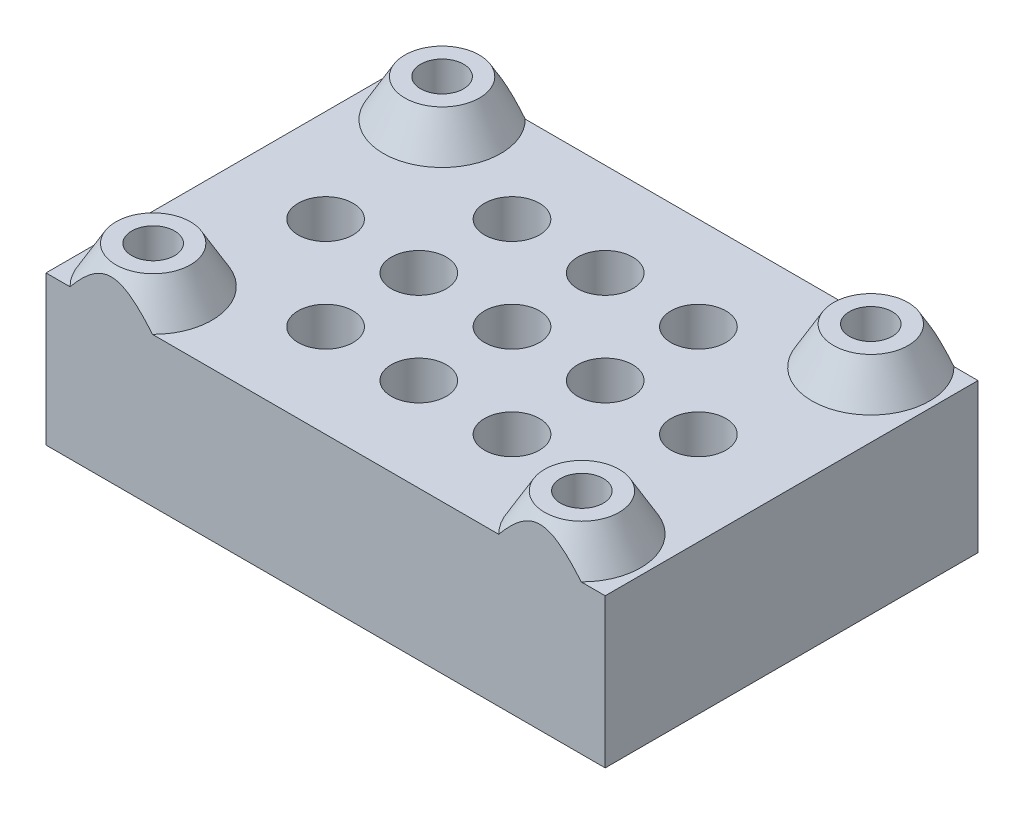
from build123d import *

# Parameters (mm, degrees)
SKETCH1_W               = 30
SKETCH1_H               = 20
BOSS_EXTRUDE1_DEPTH     = 8
SKETCH2_R               = 0.95
CUT_EXTRUDE1_DEPTH      = 20.723082923
BOSS_EXTRUDE2_START     = 2
SKETCH3_R               = 2
SKETCH3_R_2             = 0.95
BOSS_EXTRUDE2_DEPTH     = 2
CHAMFER1_SIZE           = 1.154700538
CHAMFER1_SIZE_2         = 2
SKETCH4_R               = 1.475
CUT_EXTRUDE2_DEPTH      = 21.615528128
LPATTERN1_COUNT         = 5
LPATTERN1_PITCH         = 5
LPATTERN1_COUNT_DIR2    = 2
LPATTERN1_PITCH_DIR2    = 5
MIRROR1_COPY_1_SKETCH_R = 1.475
MIRROR1_COPY_1_DEPTH    = 21.615528128
MIRROR1_COPY_2_SKETCH_R = 1.475
MIRROR1_COPY_2_DEPTH    = 21.615528128
MIRROR1_COPY_3_SKETCH_R = 1.475
MIRROR1_COPY_3_DEPTH    = 21.615528128
MIRROR1_COPY_4_SKETCH_R = 1.475
MIRROR1_COPY_4_DEPTH    = 21.615528128
MIRROR1_COPY_5_SKETCH_R = 1.475
MIRROR1_COPY_5_DEPTH    = 21.615528128
MIRROR1_COPY_6_SKETCH_R = 1.475
MIRROR1_COPY_6_DEPTH    = 21.615528128
MIRROR1_COPY_7_SKETCH_R = 1.475
MIRROR1_COPY_7_DEPTH    = 21.615528128
MIRROR1_COPY_8_SKETCH_R = 1.475
MIRROR1_COPY_8_DEPTH    = 21.615528128
SKETCH5_R               = 1.15
CUT_EXTRUDE3_DEPTH      = 2


with BuildPart() as part:
    # Sketch1 → Boss-Extrude1 (new body)
    with BuildSketch(Plane(origin=(0, 0, 0), x_dir=(1, 0, 0), z_dir=(0, 1, 0))):
        Rectangle(SKETCH1_W, SKETCH1_H)
    extrude(amount=BOSS_EXTRUDE1_DEPTH)

    # Sketch2 → Cut-Extrude1 (cut, through all)
    with BuildSketch(Plane(origin=(0, 8, 0), x_dir=(1, 0, 0), z_dir=(0, 1, 0))):
        with Locations(Location((-11.5, 7.75, 0), (0, 0, 270))):
            Circle(SKETCH2_R)
        with Locations(Location((-11.5, -7.75, 0), (0, 0, 270))):
            Circle(SKETCH2_R)
        with Locations(Location((11.5, -7.75, 0), (0, 0, 270))):
            Circle(SKETCH2_R)
        with Locations(Location((11.5, 7.75, 0), (0, 0, 270))):
            Circle(SKETCH2_R)
    extrude(amount=-CUT_EXTRUDE1_DEPTH, mode=Mode.SUBTRACT)

    # Sketch3 → Boss-Extrude2 (add)
    # profile 1 of 4: a face of its own
    with BuildSketch(Plane(origin=(0, 8, 0), x_dir=(1, 0, 0), z_dir=(0, 1, 0)).offset(BOSS_EXTRUDE2_START)):
        with Locations(Location((-11.5, -7.75, 0), (0, 0, 270))):
            Circle(SKETCH3_R)
        with Locations(Location((-11.5, -7.75, 0), (0, 0, 270))):
            Circle(SKETCH3_R_2, mode=Mode.SUBTRACT)
    # profile 2 of 4: a face of its own
    with BuildSketch(Plane(origin=(0, 8, 0), x_dir=(1, 0, 0), z_dir=(0, 1, 0)).offset(BOSS_EXTRUDE2_START)):
        with Locations(Location((-11.5, 7.75, 0), (0, 0, 270))):
            Circle(SKETCH3_R)
        with Locations(Location((-11.5, 7.75, 0), (0, 0, 270))):
            Circle(SKETCH3_R_2, mode=Mode.SUBTRACT)
    # profile 3 of 4: a face of its own
    with BuildSketch(Plane(origin=(0, 8, 0), x_dir=(1, 0, 0), z_dir=(0, 1, 0)).offset(BOSS_EXTRUDE2_START)):
        with Locations(Location((11.5, 7.75, 0), (0, 0, 270))):
            Circle(SKETCH3_R)
        with Locations(Location((11.5, 7.75, 0), (0, 0, 270))):
            Circle(SKETCH3_R_2, mode=Mode.SUBTRACT)
    # profile 4 of 4: a face of its own
    with BuildSketch(Plane(origin=(0, 8, 0), x_dir=(1, 0, 0), z_dir=(0, 1, 0)).offset(BOSS_EXTRUDE2_START)):
        with Locations(Location((11.5, -7.75, 0), (0, 0, 270))):
            Circle(SKETCH3_R)
        with Locations(Location((11.5, -7.75, 0), (0, 0, 270))):
            Circle(SKETCH3_R_2, mode=Mode.SUBTRACT)
    extrude(amount=-BOSS_EXTRUDE2_DEPTH)

    # Chamfer1
    # the kernel refuses this chamfer: 2, 1.154700538 mm, written as the material it adds along each edge
    with BuildSketch(Plane(origin=(11.5, 8, -7.75), x_dir=(0, 0, 1), z_dir=(-1, 0, 0))) as chamfer1_piece_1_section:
        Polygon((2 + CHAMFER1_SIZE, 0), (2, CHAMFER1_SIZE_2), (2, 0), align=None)
    chamfer1_piece_1 = revolve(axis=Axis((11.5, 8, -7.75), (0, 1, 0)), mode=Mode.PRIVATE)
    chamfer1_piece_1 = split(chamfer1_piece_1, bisect_by=Plane(origin=(14.074735909, 8.26258781, -10), z_dir=(0, 0, 1)), keep=Keep.TOP, mode=Mode.PRIVATE)
    chamfer1_piece_1 = split(chamfer1_piece_1, bisect_by=Plane(origin=(14.074735909, 10, -6.26347553), z_dir=(0, -1, 0)), keep=Keep.TOP, mode=Mode.PRIVATE)
    add(chamfer1_piece_1)
    with BuildSketch(Plane(origin=(11.5, 8, 7.75), x_dir=(0, 0, 1), z_dir=(-1, 0, 0))) as chamfer1_piece_2_section:
        Polygon((2 + CHAMFER1_SIZE, 0), (2, CHAMFER1_SIZE_2), (2, 0), align=None)
    chamfer1_piece_2 = revolve(axis=Axis((11.5, 8, 7.75), (0, 1, 0)), mode=Mode.PRIVATE)
    chamfer1_piece_2 = split(chamfer1_piece_2, bisect_by=Plane(origin=(11.5, 8.952348486, 10), z_dir=(0, 0, -1)), keep=Keep.TOP, mode=Mode.PRIVATE)
    chamfer1_piece_2 = split(chamfer1_piece_2, bisect_by=Plane(origin=(11.5, 10, 5.175184574), z_dir=(0, -1, 0)), keep=Keep.TOP, mode=Mode.PRIVATE)
    add(chamfer1_piece_2)
    with BuildSketch(Plane(origin=(-11.5, 8, -7.75), x_dir=(0, 0, 1), z_dir=(-1, 0, 0))) as chamfer1_piece_3_section:
        Polygon((2 + CHAMFER1_SIZE, 0), (2, CHAMFER1_SIZE_2), (2, 0), align=None)
    chamfer1_piece_3 = revolve(axis=Axis((-11.5, 8, -7.75), (0, 1, 0)), mode=Mode.PRIVATE)
    chamfer1_piece_3 = split(chamfer1_piece_3, bisect_by=Plane(origin=(-8.925264091, 8.26258781, -10), z_dir=(0, 0, 1)), keep=Keep.TOP, mode=Mode.PRIVATE)
    chamfer1_piece_3 = split(chamfer1_piece_3, bisect_by=Plane(origin=(-8.925264091, 10, -6.26347553), z_dir=(0, -1, 0)), keep=Keep.TOP, mode=Mode.PRIVATE)
    add(chamfer1_piece_3)
    with BuildSketch(Plane(origin=(-11.5, 8, 7.75), x_dir=(0, 0, 1), z_dir=(-1, 0, 0))) as chamfer1_piece_4_section:
        Polygon((2 + CHAMFER1_SIZE, 0), (2, CHAMFER1_SIZE_2), (2, 0), align=None)
    chamfer1_piece_4 = revolve(axis=Axis((-11.5, 8, 7.75), (0, 1, 0)), mode=Mode.PRIVATE)
    chamfer1_piece_4 = split(chamfer1_piece_4, bisect_by=Plane(origin=(-11.5, 8.952348486, 10), z_dir=(0, 0, -1)), keep=Keep.TOP, mode=Mode.PRIVATE)
    chamfer1_piece_4 = split(chamfer1_piece_4, bisect_by=Plane(origin=(-11.5, 10, 5.175184573), z_dir=(0, -1, 0)), keep=Keep.TOP, mode=Mode.PRIVATE)
    add(chamfer1_piece_4)

    # Sketch4 → Cut-Extrude2 (cut, through all)
    with BuildSketch(Plane.XZ):
        with Locations(Location((-10, 0, 0), (0, 0, 270))):
            Circle(SKETCH4_R)
    cut_extrude2 = extrude(amount=-CUT_EXTRUDE2_DEPTH, mode=Mode.SUBTRACT)

    # LPattern1: Cut-Extrude2 5 × 2, 2 skipped
    with Locations(*[(i * LPATTERN1_PITCH, 0, j * LPATTERN1_PITCH_DIR2) for i in range(LPATTERN1_COUNT) for j in range(LPATTERN1_COUNT_DIR2) if (i, j) not in ((0, 0), (0, 1), (4, 1))]):
        add(cut_extrude2, mode=Mode.SUBTRACT)

    # Mirror1 copy 1 sketch → Mirror1 copy 1 (cut, through all)
    with BuildSketch(Plane(origin=(5, 0, 0), x_dir=(1, 0, 0), z_dir=(0, -1, 0))):
        with Locations((-10, 0)):
            Circle(MIRROR1_COPY_1_SKETCH_R)
    extrude(amount=-MIRROR1_COPY_1_DEPTH, mode=Mode.SUBTRACT)

    # Mirror1 copy 2 sketch → Mirror1 copy 2 (cut, through all)
    with BuildSketch(Plane(origin=(5, 0, -5), x_dir=(1, 0, 0), z_dir=(0, -1, 0))):
        with Locations((-10, 0)):
            Circle(MIRROR1_COPY_2_SKETCH_R)
    extrude(amount=-MIRROR1_COPY_2_DEPTH, mode=Mode.SUBTRACT)

    # Mirror1 copy 3 sketch → Mirror1 copy 3 (cut, through all)
    with BuildSketch(Plane(origin=(10, 0, 0), x_dir=(1, 0, 0), z_dir=(0, -1, 0))):
        with Locations((-10, 0)):
            Circle(MIRROR1_COPY_3_SKETCH_R)
    extrude(amount=-MIRROR1_COPY_3_DEPTH, mode=Mode.SUBTRACT)

    # Mirror1 copy 4 sketch → Mirror1 copy 4 (cut, through all)
    with BuildSketch(Plane(origin=(10, 0, -5), x_dir=(1, 0, 0), z_dir=(0, -1, 0))):
        with Locations((-10, 0)):
            Circle(MIRROR1_COPY_4_SKETCH_R)
    extrude(amount=-MIRROR1_COPY_4_DEPTH, mode=Mode.SUBTRACT)

    # Mirror1 copy 5 sketch → Mirror1 copy 5 (cut, through all)
    with BuildSketch(Plane(origin=(15, 0, 0), x_dir=(1, 0, 0), z_dir=(0, -1, 0))):
        with Locations((-10, 0)):
            Circle(MIRROR1_COPY_5_SKETCH_R)
    extrude(amount=-MIRROR1_COPY_5_DEPTH, mode=Mode.SUBTRACT)

    # Mirror1 copy 6 sketch → Mirror1 copy 6 (cut, through all)
    with BuildSketch(Plane(origin=(15, 0, -5), x_dir=(1, 0, 0), z_dir=(0, -1, 0))):
        with Locations((-10, 0)):
            Circle(MIRROR1_COPY_6_SKETCH_R)
    extrude(amount=-MIRROR1_COPY_6_DEPTH, mode=Mode.SUBTRACT)

    # Mirror1 copy 7 sketch → Mirror1 copy 7 (cut, through all)
    with BuildSketch(Plane(origin=(20, 0, 0), x_dir=(1, 0, 0), z_dir=(0, -1, 0))):
        with Locations((-10, 0)):
            Circle(MIRROR1_COPY_7_SKETCH_R)
    extrude(amount=-MIRROR1_COPY_7_DEPTH, mode=Mode.SUBTRACT)

    # Mirror1 copy 8 sketch → Mirror1 copy 8 (cut, through all)
    with BuildSketch(Plane.XZ):
        with Locations((-10, 0)):
            Circle(MIRROR1_COPY_8_SKETCH_R)
    extrude(amount=-MIRROR1_COPY_8_DEPTH, mode=Mode.SUBTRACT)

    # Sketch5 → Cut-Extrude3 (cut)
    with BuildSketch(Plane(origin=(0, 10, 0), x_dir=(1, 0, 0), z_dir=(0, 1, 0))):
        with Locations(Location((-11.5, 7.75, 0), (0, 0, 270))):
            Circle(SKETCH5_R)
        with Locations(Location((-11.5, -7.75, 0), (0, 0, 270))):
            Circle(SKETCH5_R)
        with Locations(Location((11.5, 7.75, 0), (0, 0, 270))):
            Circle(SKETCH5_R)
        with Locations(Location((11.5, -7.75, 0), (0, 0, 270))):
            Circle(SKETCH5_R)
    extrude(amount=-CUT_EXTRUDE3_DEPTH, mode=Mode.SUBTRACT)


solid = part.part
